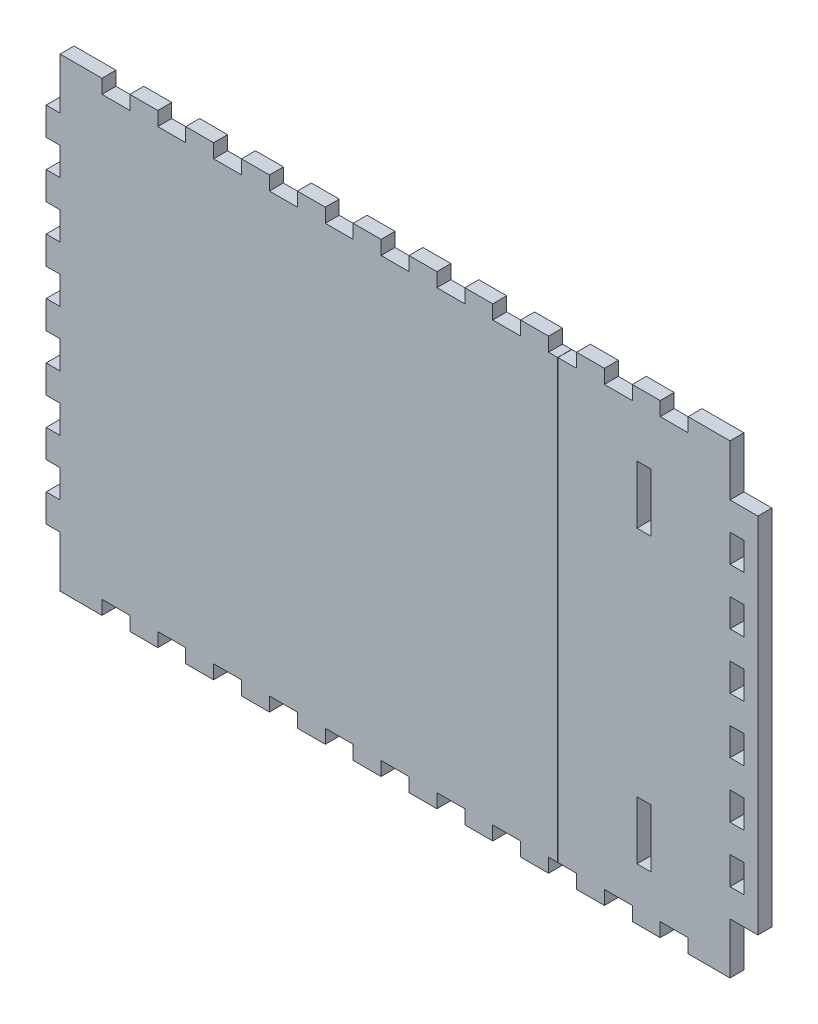
from build123d import *

# Parameters (mm, degrees)
BOSS_EXTRUDE1_DEPTH = 6
SKETCH2_W           = 6
SKETCH2_H           = 25
SKETCH2_W_2         = 0.1
SKETCH2_H_2         = 235.31007752
CUT_EXTRUDE1_DEPTH  = 6
SKETCH4_W           = 6
SKETCH4_H           = 156
BOSS_EXTRUDE2_DEPTH = 6


with BuildPart() as part:
    # Model → Boss-Extrude1 (new body)
    with BuildSketch(Plane.XY):
        Polygon((209, 203), (209, 181), (203, 181), (203, 169), (209, 169), (209, 157), (203, 157), (203, 145), (209, 145), (209, 133), (203, 133), (203, 121), (209, 121), (209, 109), (203, 109), (203, 97), (209, 97), (209, 85), (203, 85), (203, 73), (209, 73), (209, 61), (203, 61), (203, 49), (209, 49), (209, 37), (203, 37), (203, 25), (209, 25), (209, 13), (209, 3), (227, 3), (227, 9), (239, 9), (239, 3), (251, 3), (251, 9), (263, 9), (263, 3), (275, 3), (275, 9), (287, 9), (287, 3), (299, 3), (299, 9), (311, 9), (311, 3), (323, 3), (323, 9), (335, 9), (335, 3), (347, 3), (347, 9), (359, 9), (359, 3), (371, 3), (371, 9), (383, 9), (383, 3), (395, 3), (395, 9), (407, 9), (407, 3), (419, 3), (419, 9), (431, 9), (431, 3), (443, 3), (443, 9), (455, 9), (455, 3), (467, 3), (467, 9), (479, 9), (479, 3), (491, 3), (497, 3), (497, 25), (503, 25), (503, 37), (497, 37), (497, 49), (503, 49), (503, 61), (497, 61), (497, 73), (503, 73), (503, 85), (497, 85), (497, 97), (503, 97), (503, 109), (497, 109), (497, 121), (503, 121), (503, 133), (497, 133), (497, 145), (503, 145), (503, 157), (497, 157), (497, 169), (503, 169), (503, 181), (497, 181), (497, 193), (497, 203), (479, 203), (479, 197), (467, 197), (467, 203), (455, 203), (455, 197), (443, 197), (443, 203), (431, 203), (431, 197), (419, 197), (419, 203), (407, 203), (407, 197), (395, 197), (395, 203), (383, 203), (383, 197), (371, 197), (371, 203), (359, 203), (359, 197), (347, 197), (347, 203), (335, 203), (335, 197), (323, 197), (323, 203), (311, 203), (311, 197), (299, 197), (299, 203), (287, 203), (287, 197), (275, 197), (275, 203), (263, 203), (263, 197), (251, 197), (251, 203), (239, 203), (239, 197), (227, 197), (227, 203), (215, 203), align=None)
    extrude(amount=BOSS_EXTRUDE1_DEPTH)

    # Sketch2 → Cut-Extrude1 (cut)
    with BuildSketch(Plane.XY.offset(6)):
        with Locations((460, 163)):
            Rectangle(SKETCH2_W, SKETCH2_H)
        with Locations((422.95, 100.5)):
            Rectangle(SKETCH2_W_2, SKETCH2_H_2)
        with Locations((460, 38)):
            Rectangle(SKETCH2_W, SKETCH2_H)
    extrude(amount=-CUT_EXTRUDE1_DEPTH, mode=Mode.SUBTRACT)


with BuildPart() as cut_extrude1_piece_1:
    # of the separate pieces the step leaves, piece 1, a body of its own (cut_extrude1_pieces)
    add(part.part.solids().sort_by_distance((209, 203, 0))[0])


with BuildPart() as cut_extrude1_piece_2:
    # of the separate pieces the step leaves, piece 2, a body of its own (cut_extrude1_pieces)
    add(part.part.solids().sort_by_distance((431, 197, 0))[0])

    # Sketch4 → Boss-Extrude2 (add)
    with BuildSketch(Plane(origin=(503, 0, 0), x_dir=(0, 0, -1), z_dir=(1, 0, 0))):
        with Locations((-3, 103)):
            Rectangle(SKETCH4_W, SKETCH4_H)
    extrude(amount=BOSS_EXTRUDE2_DEPTH)


solid = Compound([cut_extrude1_piece_1.part, cut_extrude1_piece_2.part])
